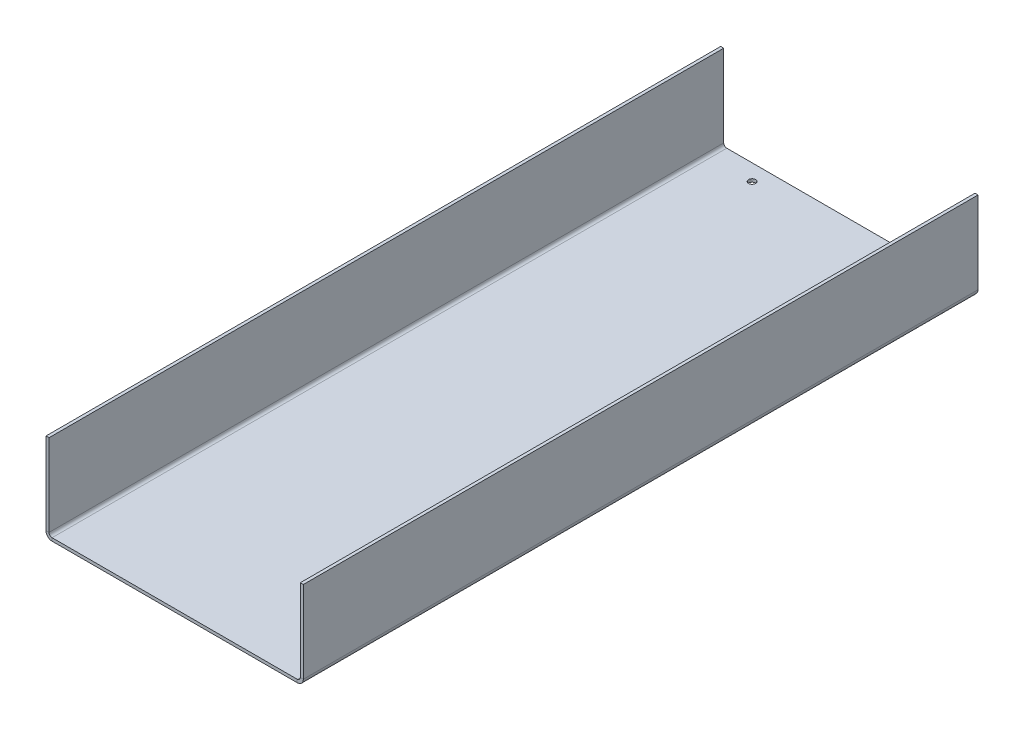
from build123d import *

# Parameters (mm, degrees)
SM_TRAY_DEPTH       = 333
SK_FACEHOLES_R      = 1.7
CUT_FACEHOLES_DEPTH = 1.5


# Sheet-metal steps are written as plain solids
with BuildPart() as part:
    # SK_Tray → SM_Tray (new body)
    with BuildSketch(Plane.XY.offset(-208)):
        with BuildLine():
            Line((-62, 43.5), (-62, 3))
            ThreePointArc((-62, 3), (-61.560660172, 1.939339828), (-60.5, 1.5))
            Line((-60.5, 1.5), (60.5, 1.5))
            ThreePointArc((60.5, 1.5), (61.560660172, 1.939339828), (62, 3))
            Line((62, 3), (62, 43.5))
            Line((62, 43.5), (63.5, 43.5))
            Line((63.5, 43.5), (63.5, 3))
            ThreePointArc((63.5, 3), (62.621320344, 0.878679656), (60.5, 0))
            Line((60.5, 0), (-60.5, 0))
            ThreePointArc((-60.5, 0), (-62.621320344, 0.878679656), (-63.5, 3))
            Line((-63.5, 3), (-63.5, 43.5))
            Line((-63.5, 43.5), (-62, 43.5))
        make_face()
    extrude(amount=SM_TRAY_DEPTH)

    # SK_FaceHoles → CUT_FaceHoles (cut)
    with BuildSketch(Plane(origin=(0, 0, 0), x_dir=(1, 0, 0), z_dir=(0, 1, 0))):
        with Locations(Location((40, 200, 0), (0, 0, 270))):
            Circle(SK_FACEHOLES_R)
        with Locations(Location((-40, 200, 0), (0, 0, 270))):
            Circle(SK_FACEHOLES_R)
    extrude(amount=CUT_FACEHOLES_DEPTH, mode=Mode.SUBTRACT)


solid = part.part
